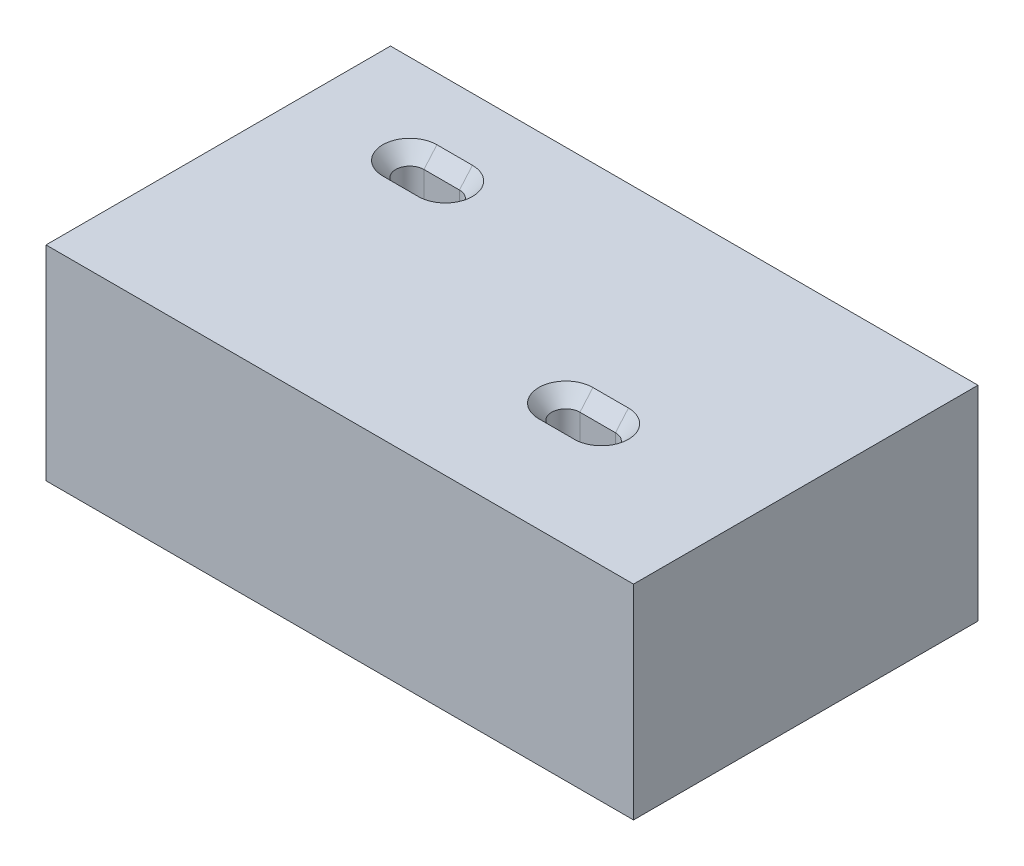
from build123d import *

# Parameters (mm, degrees)
SKETCH1_W                                      = 209.952415438
SKETCH1_H                                      = 123.10253427
BOSS_EXTRUDE1_DEPTH                            = 73
CSK_START                                      = -1
CSK_SLOT_FOR_3_8_FLAT_HEAD_MACHINE_SCREW_DEPTH = 74


with BuildPart() as part:
    # Sketch1 → Boss-Extrude1 (new body)
    with BuildSketch(Plane(origin=(0, 0, 0), x_dir=(1, 0, 0), z_dir=(0, 1, 0))):
        Rectangle(SKETCH1_W, SKETCH1_H)
    extrude(amount=BOSS_EXTRUDE1_DEPTH)

    # CSK SLOT for 3/8 Flat Head Machine Screw1: read off the stored shape, not the designer's step
    # CSK SLOT for 3_8 Flat Head Machine S 2 → CSK SLOT for 3/8 Flat Head Machine Screw1 (cut)
    with BuildSketch(Plane(origin=(0, 0, 0), x_dir=(1, 0, 0), z_dir=(0, 1, 0)).offset(CSK_START)):
        with BuildLine():
            Line((36.875245681, -22.680413351), (49.575245681, -22.680413351))
            ThreePointArc((49.575245681, -22.680413351), (54.617145681, -17.638513351), (49.575245681, -12.596613351))
            Line((49.575245681, -12.596613351), (36.875245681, -12.596613351))
            ThreePointArc((36.875245681, -12.596613351), (31.833345681, -17.638513351), (36.875245681, -22.680413351))
        make_face()
        with BuildLine():
            Line((-66.124961912, 24.573381676), (-53.424961912, 24.573381676))
            ThreePointArc((-53.424961912, 24.573381676), (-48.383061912, 29.615281676), (-53.424961912, 34.657181676))
            Line((-53.424961912, 34.657181676), (-66.124961912, 34.657181676))
            ThreePointArc((-66.124961912, 34.657181676), (-71.166861912, 29.615281676), (-66.124961912, 24.573381676))
        make_face()
    extrude(amount=CSK_SLOT_FOR_3_8_FLAT_HEAD_MACHINE_SCREW_DEPTH, mode=Mode.SUBTRACT)

    # CSK SLOT for 3_8 Flat Head Machine S 3: loft between two sections, ruled curve by curve
    csk_slot_for_3_8_flat_head_machine_s_3_from = [
        Edge.make_three_point_arc((49.575245681, 67.667467248, 22.680413351), (53.140407361, 67.667467248, 21.203675031), (54.617145681, 67.667467248, 17.638513351)),
        Edge.make_three_point_arc((54.617145681, 67.667467248, 17.638513351), (53.140407361, 67.667467248, 14.073351671), (49.575245681, 67.667467248, 12.596613351)),
        Edge.make_three_point_arc((36.875245681, 67.667467248, 12.596613351), (33.310084001, 67.667467248, 14.073351671), (31.833345681, 67.667467248, 17.638513351)),
        Edge.make_three_point_arc((31.833345681, 67.667467248, 17.638513351), (33.310084001, 67.667467248, 21.203675031), (36.875245681, 67.667467248, 22.680413351)),
        Edge.make_line((49.575245681, 67.667467248, 12.596613351), (36.875245681, 67.667467248, 12.596613351)),
        Edge.make_line((49.575245681, 67.667467248, 22.680413351), (36.875245681, 67.667467248, 22.680413351)),
    ]
    csk_slot_for_3_8_flat_head_machine_s_3_to = [
        Edge.make_three_point_arc((49.575245681, 73, 27.315913351), (56.418200846, 73, 24.481468515), (59.252645681, 73, 17.638513351)),
        Edge.make_three_point_arc((59.252645681, 73, 17.638513351), (56.418200846, 73, 10.795558187), (49.575245681, 73, 7.961113351)),
        Edge.make_three_point_arc((36.875245681, 73, 7.961113351), (30.032290517, 73, 10.795558187), (27.197845681, 73, 17.638513351)),
        Edge.make_three_point_arc((27.197845681, 73, 17.638513351), (30.032290517, 73, 24.481468515), (36.875245681, 73, 27.315913351)),
        Edge.make_line((49.575245681, 73, 7.961113351), (36.875245681, 73, 7.961113351)),
        Edge.make_line((49.575245681, 73, 27.315913351), (36.875245681, 73, 27.315913351)),
    ]
    csk_slot_for_3_8_flat_head_machine_s_3 = Solid(Shell([*[Face.make_surface_from_curves(csk_slot_for_3_8_flat_head_machine_s_3_from[k], csk_slot_for_3_8_flat_head_machine_s_3_to[k]) for k in range(6)], Face(Wire(csk_slot_for_3_8_flat_head_machine_s_3_from)), Face(Wire(csk_slot_for_3_8_flat_head_machine_s_3_to))]))
    add(csk_slot_for_3_8_flat_head_machine_s_3, mode=Mode.SUBTRACT)

    # CSK SLOT for 3_8 Flat Head Machine S 4: loft between two sections, ruled curve by curve
    csk_slot_for_3_8_flat_head_machine_s_4_from = [
        Edge.make_three_point_arc((-53.424961912, 67.667467248, -24.573381676), (-49.859800232, 67.667467248, -26.050119996), (-48.383061912, 67.667467248, -29.615281676)),
        Edge.make_three_point_arc((-48.383061912, 67.667467248, -29.615281676), (-49.859800232, 67.667467248, -33.180443356), (-53.424961912, 67.667467248, -34.657181676)),
        Edge.make_three_point_arc((-66.124961912, 67.667467248, -34.657181676), (-69.690123592, 67.667467248, -33.180443356), (-71.166861912, 67.667467248, -29.615281676)),
        Edge.make_three_point_arc((-71.166861912, 67.667467248, -29.615281676), (-69.690123592, 67.667467248, -26.050119996), (-66.124961912, 67.667467248, -24.573381676)),
        Edge.make_line((-53.424961912, 67.667467248, -34.657181676), (-66.124961912, 67.667467248, -34.657181676)),
        Edge.make_line((-53.424961912, 67.667467248, -24.573381676), (-66.124961912, 67.667467248, -24.573381676)),
    ]
    csk_slot_for_3_8_flat_head_machine_s_4_to = [
        Edge.make_three_point_arc((-53.424961912, 73, -19.937881676), (-46.582006748, 73, -22.772326512), (-43.747561912, 73, -29.615281676)),
        Edge.make_three_point_arc((-43.747561912, 73, -29.615281676), (-46.582006748, 73, -36.45823684), (-53.424961912, 73, -39.292681676)),
        Edge.make_three_point_arc((-66.124961912, 73, -39.292681676), (-72.967917076, 73, -36.45823684), (-75.802361912, 73, -29.615281676)),
        Edge.make_three_point_arc((-75.802361912, 73, -29.615281676), (-72.967917076, 73, -22.772326512), (-66.124961912, 73, -19.937881676)),
        Edge.make_line((-53.424961912, 73, -39.292681676), (-66.124961912, 73, -39.292681676)),
        Edge.make_line((-53.424961912, 73, -19.937881676), (-66.124961912, 73, -19.937881676)),
    ]
    csk_slot_for_3_8_flat_head_machine_s_4 = Solid(Shell([*[Face.make_surface_from_curves(csk_slot_for_3_8_flat_head_machine_s_4_from[k], csk_slot_for_3_8_flat_head_machine_s_4_to[k]) for k in range(6)], Face(Wire(csk_slot_for_3_8_flat_head_machine_s_4_from)), Face(Wire(csk_slot_for_3_8_flat_head_machine_s_4_to))]))
    add(csk_slot_for_3_8_flat_head_machine_s_4, mode=Mode.SUBTRACT)


solid = part.part
